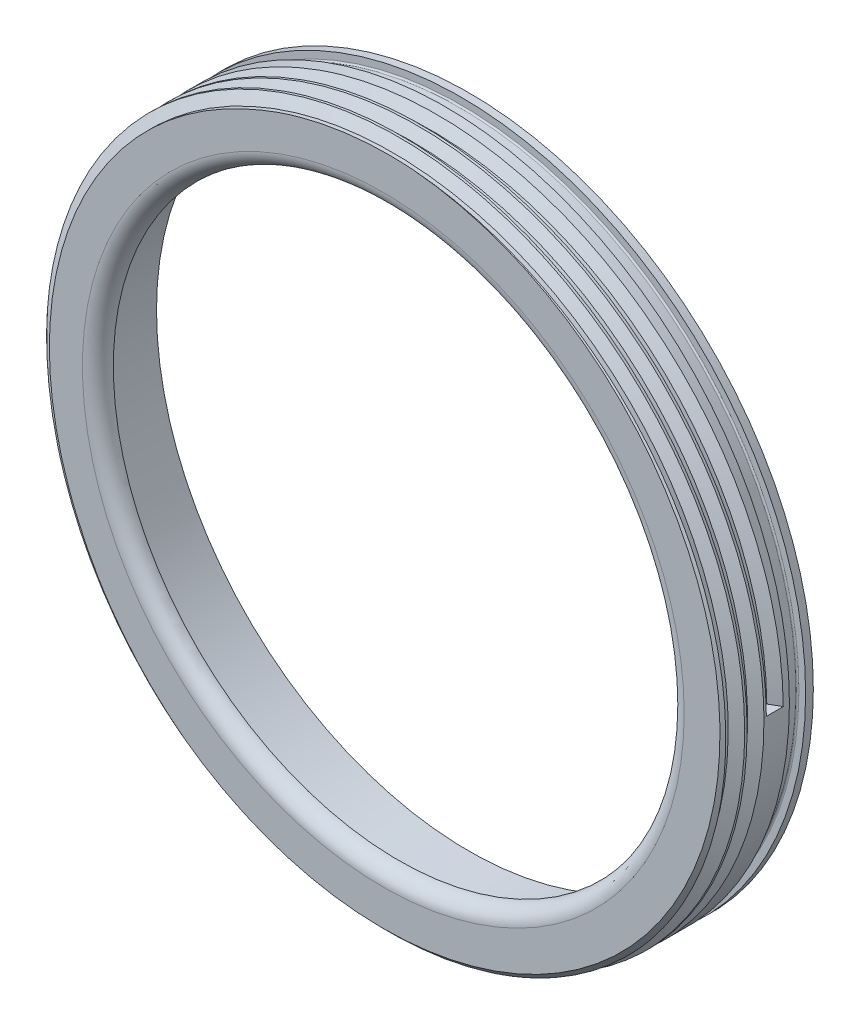
from build123d import *

# Parameters (mm, degrees)
SKETCH1_R           = 56.6928
SKETCH1_R_2         = 51.435
BOSS_EXTRUDE1_DEPTH = 1.27
SKETCH3_R           = 55.3339
SKETCH3_R_2         = 51.435
BOSS_EXTRUDE2_DEPTH = 2.667
SKETCH4_R           = 56.6928
SKETCH4_R_2         = 51.435
BOSS_EXTRUDE3_DEPTH = 7.62
SKETCH18_R          = 56.6928
SKETCH18_R_2        = 46.99
BOSS_EXTRUDE4_DEPTH = 2.54
FILLET1_R           = 0.254
FILLET2_R           = 2.54
THREAD2_PITCH       = 3.175


with BuildPart() as part:
    # Sketch1 → Boss-Extrude1 (new body)
    with BuildSketch(Plane.XY):
        with Locations((-54.462846348, 14.706120018)):
            Circle(SKETCH1_R)
        with Locations((-54.462846348, 14.706120018)):
            Circle(SKETCH1_R_2, mode=Mode.SUBTRACT)
    extrude(amount=BOSS_EXTRUDE1_DEPTH)

    # Sketch3 → Boss-Extrude2 (add)
    with BuildSketch(Plane.XY.offset(1.27)):
        with Locations((-54.462846348, 14.706120018)):
            Circle(SKETCH3_R)
        with Locations((-54.462846348, 14.706120018)):
            Circle(SKETCH3_R_2, mode=Mode.SUBTRACT)
    extrude(amount=BOSS_EXTRUDE2_DEPTH)

    # Sketch4 → Boss-Extrude3 (add)
    with BuildSketch(Plane.XY.offset(3.937)):
        with Locations((-54.462846348, 14.706120018)):
            Circle(SKETCH4_R)
        with Locations((-54.462846348, 14.706120018)):
            Circle(SKETCH4_R_2, mode=Mode.SUBTRACT)
    extrude(amount=BOSS_EXTRUDE3_DEPTH)

    # Sketch18 → Boss-Extrude4 (add)
    with BuildSketch(Plane.XY.offset(11.557)):
        with Locations((-54.462846348, 14.706120018)):
            Circle(SKETCH18_R)
        with Locations((-54.462846348, 14.706120018)):
            Circle(SKETCH18_R_2, mode=Mode.SUBTRACT)
    extrude(amount=BOSS_EXTRUDE4_DEPTH)

    # Fillet1
    fillet1_edges = [part.edges().sort_by_distance(p)[0] for p in [
        (-109.796746348, 14.706120018, 3.937),
        (-109.796746348, 14.706120018, 1.27),
    ]]
    fillet(fillet1_edges, radius=FILLET1_R)

    # Fillet2
    fillet2_edges = [part.edges().sort_by_distance(p)[0] for p in [
        (-101.452846348, 14.706120018, 14.097),
    ]]
    fillet(fillet2_edges, radius=FILLET2_R - 0.0001)  # a hair under: the kernel refuses the full size

    # Chamfer3: read off the stored shape, not the designer's step
    # Chamfer3 outline → Chamfer3 (revolve, cut)
    with BuildSketch(Plane(origin=(-54.462846348, 14.706120018, 0), x_dir=(1, 0, 0), z_dir=(0, -1, 0))):
        Polygon((56.6928, 14.097), (55.4228, 14.097), (56.6928, 12.827), align=None)
    revolve(axis=Axis((-54.462846348, 14.706120018, 0), (0, 0, 1)), mode=Mode.SUBTRACT)

    # Thread2: arcs per turn and ends read off the stored shape
    # Thread2: the profile of Thread Profile2 profile screwed along a right-hand helix through 3 turns, 12 arcs to a turn; built about Z, then put on its axis
    thread2_z = Axis((0, 0, 0), (0, 0, 1))
    thread2_corners = [(56.6931, 0, -0.000173205), (56.6931, 0, 2.778298196), (54.974280847, 0, 1.785937496), (54.974280847, 0, 0.992187496)]
    with BuildLine(mode=Mode.PRIVATE) as thread2_profile:
        Line(thread2_corners[0], thread2_corners[1])
        Line(thread2_corners[1], thread2_corners[2])
        Line(thread2_corners[2], thread2_corners[3])
        Line(thread2_corners[3], thread2_corners[0])
    thread2_cap = Face(thread2_profile.wire())
    thread2_turn_angles = [0, 15, 30, 45, 60, 75, 90, 105, 120, 135, 150, 165, 180, 195, 210, 225, 240, 255, 270, 285, 300, 315, 330, 345, 360]
    thread2_turn_weights = [1, 0.9659258262890683, 1, 0.9659258262890683, 1, 0.9659258262890683, 1, 0.9659258262890683, 1, 0.9659258262890683, 1, 0.9659258262890683, 1, 0.9659258262890683, 1, 0.9659258262890683, 1, 0.9659258262890683, 1, 0.9659258262890683, 1, 0.9659258262890683, 1, 0.9659258262890683, 1]
    thread2_turn_rails = [Edge.make_bspline([Vector(p[0], p[1], 0).rotate(thread2_z, thread2_turn_angles[k]) / thread2_turn_weights[k] + Vector(0, 0, p[2] + THREAD2_PITCH * thread2_turn_angles[k] / 360) for k in range(25)], [0, 0, 0, 1, 1, 2, 2, 3, 3, 4, 4, 5, 5, 6, 6, 7, 7, 8, 8, 9, 9, 10, 10, 11, 11, 12, 12, 12], 2, thread2_turn_weights) for p in thread2_corners]
    thread2_turn_sides = [Face.make_surface_from_curves(thread2_turn_rails[p[0]], thread2_turn_rails[p[1]]) for p in [(0, 1), (1, 2), (2, 3), (3, 0)]]
    thread2 = Plane(origin=(-54.462846348, 14.706120018, 4.953), x_dir=(1, 0, 0), z_dir=(0, 0, 1)) * Solid(Shell([*[p.moved(Location((0, 0, THREAD2_PITCH * i))) for i in range(3) for p in thread2_turn_sides], thread2_cap, thread2_cap.rotate(thread2_z, 1080).moved(Location((0, 0, THREAD2_PITCH * 1080 / 360)))]))
    add(thread2, mode=Mode.SUBTRACT)


solid = part.part
